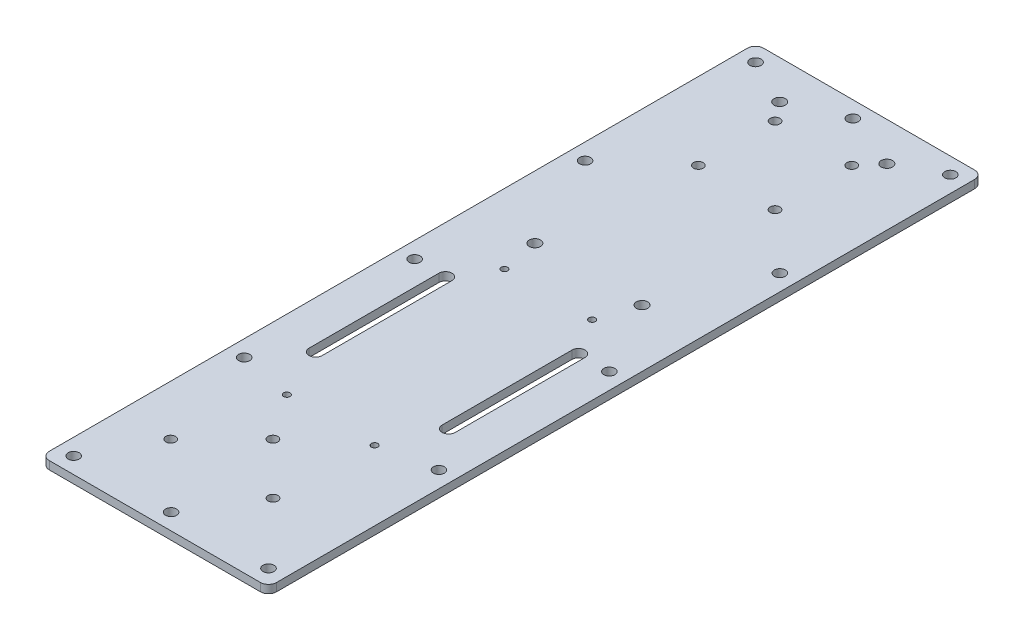
from build123d import *

# Parameters (mm, degrees)
PLATE_THICKNESS_DEPTH      = 3.175
SKETCH3_R                  = 2.159
MOUNTING_HOLES_DEPTH       = 147.635511132
SKETCH4_R                  = 2.2225
JETSON_HOLES_W_MOUNT_DEPTH = 147.635511132
SKETCH5_R                  = 1.905
PDB_HOLES_DEPTH            = 147.635511132
SKETCH6_R                  = 1.905
LIDAR_HOLES_DEPTH          = 147.635511132
SKETCH7_R                  = 1.27
PIXHAWK_HOLES_DEPTH        = 147.635511132
BATTERY_HOLES_DEPTH        = 147.635511132


with BuildPart() as part:
    # Sketch2 → Plate Thickness (new body)
    with BuildSketch(Plane(origin=(0, 0, 0), x_dir=(1, 0, 0), z_dir=(0, 1, 0))):
        with BuildLine():
            Line((-41.275, 139.7), (41.275, 139.7))
            ThreePointArc((41.275, 139.7), (43.52006403, 138.77006403), (44.45, 136.525))
            Line((44.45, 136.525), (44.45, -136.525))
            ThreePointArc((44.45, -136.525), (43.52006403, -138.77006403), (41.275, -139.7))
            Line((41.275, -139.7), (-41.275, -139.7))
            ThreePointArc((-41.275, -139.7), (-43.52006403, -138.77006403), (-44.45, -136.525))
            Line((-44.45, -136.525), (-44.45, 136.525))
            ThreePointArc((-44.45, 136.525), (-43.52006403, 138.77006403), (-41.275, 139.7))
        make_face()
    extrude(amount=PLATE_THICKNESS_DEPTH)

    # Sketch3 → Mounting holes (cut, through all)
    with BuildSketch(Plane(origin=(0, 3.175, 0), x_dir=(1, 0, 0), z_dir=(0, 1, 0))):
        with Locations((-38.1, 133.35)):
            Circle(SKETCH3_R)
        with Locations((-38.1, 66.675)):
            Circle(SKETCH3_R)
        with Locations((-38.1, -66.675)):
            Circle(SKETCH3_R)
        with Locations((-38.1, -133.35)):
            Circle(SKETCH3_R)
        with Locations((38.1, -133.35)):
            Circle(SKETCH3_R)
        with Locations((38.1, -66.675)):
            Circle(SKETCH3_R)
        with Locations((38.1, 66.675)):
            Circle(SKETCH3_R)
        with Locations((38.1, 133.35)):
            Circle(SKETCH3_R)
        with Locations((0, 133.35)):
            Circle(SKETCH3_R)
        with Locations((0, -133.35)):
            Circle(SKETCH3_R)
        with Locations((-38.1, 0)):
            Circle(SKETCH3_R)
        with Locations((38.1, 0)):
            Circle(SKETCH3_R)
    extrude(amount=-MOUNTING_HOLES_DEPTH, mode=Mode.SUBTRACT)

    # Sketch4 → Jetson Holes (w/ mount) (cut, through all)
    with BuildSketch(Plane(origin=(0, 3.175, 0), x_dir=(1, 0, 0), z_dir=(0, 1, 0))):
        with Locations((-19.937372124, 124.652240808)):
            Circle(SKETCH4_R)
        with Locations((-19.937372124, 28.894240808)):
            Circle(SKETCH4_R)
        with Locations((21.972627876, 28.894240808)):
            Circle(SKETCH4_R)
        with Locations((21.972627876, 124.652240808)):
            Circle(SKETCH4_R)
    extrude(amount=-JETSON_HOLES_W_MOUNT_DEPTH, mode=Mode.SUBTRACT)

    # Sketch5 → PDB holes (cut, through all)
    with BuildSketch(Plane(origin=(0, 3.175, 0), x_dir=(1, 0, 0), z_dir=(0, 1, 0))):
        with Locations((-14.341868752, 117.235149692)):
            Circle(SKETCH5_R)
        with Locations((15.655531248, 117.235149692)):
            Circle(SKETCH5_R)
        with Locations((15.655531248, 87.237749692)):
            Circle(SKETCH5_R)
        with Locations((-14.341868752, 87.237749692)):
            Circle(SKETCH5_R)
    extrude(amount=-PDB_HOLES_DEPTH, mode=Mode.SUBTRACT)

    # Sketch6 → Lidar Holes (cut, through all)
    with BuildSketch(Plane(origin=(0, 3.175, 0), x_dir=(1, 0, 0), z_dir=(0, 1, 0))):
        with Locations((-24.793877358, -108.717504265)):
            Circle(SKETCH6_R)
        with Locations((15.211122642, -108.717504265)):
            Circle(SKETCH6_R)
        with Locations((-4.804077358, -88.727704265)):
            Circle(SKETCH6_R)
    extrude(amount=-LIDAR_HOLES_DEPTH, mode=Mode.SUBTRACT)

    # Sketch7 → PixHawk Holes (cut, through all)
    with BuildSketch(Plane(origin=(0, 3.175, 0), x_dir=(1, 0, 0), z_dir=(0, 1, 0))):
        with Locations((-17.145, 14.172396373)):
            Circle(SKETCH7_R)
        with Locations((-17.145, -70.917603627)):
            Circle(SKETCH7_R)
        with Locations((17.145, -70.917603627)):
            Circle(SKETCH7_R)
        with Locations((17.145, 14.172396373)):
            Circle(SKETCH7_R)
    extrude(amount=-PIXHAWK_HOLES_DEPTH, mode=Mode.SUBTRACT)

    # Sketch8 → Battery Holes (cut, through all)
    with BuildSketch(Plane(origin=(0, 3.175, 0), x_dir=(1, 0, 0), z_dir=(0, 1, 0))):
        with BuildLine():
            Line((-23.495, -0.005964701), (-23.495, -50.805964701))
            ThreePointArc((-23.495, -50.805964701), (-26.035, -53.345964701), (-28.575, -50.805964701))
            Line((-28.575, -50.805964701), (-28.575, -0.005964701))
            ThreePointArc((-28.575, -0.005964701), (-26.035, 2.534035299), (-23.495, -0.005964701))
        make_face()
        with BuildLine():
            Line((23.495, -0.005964701), (23.495, -50.805964701))
            ThreePointArc((23.495, -50.805964701), (26.035, -53.345964701), (28.575, -50.805964701))
            Line((28.575, -50.805964701), (28.575, -0.005964701))
            ThreePointArc((28.575, -0.005964701), (26.035, 2.534035299), (23.495, -0.005964701))
        make_face()
    extrude(amount=-BATTERY_HOLES_DEPTH, mode=Mode.SUBTRACT)


solid = part.part
